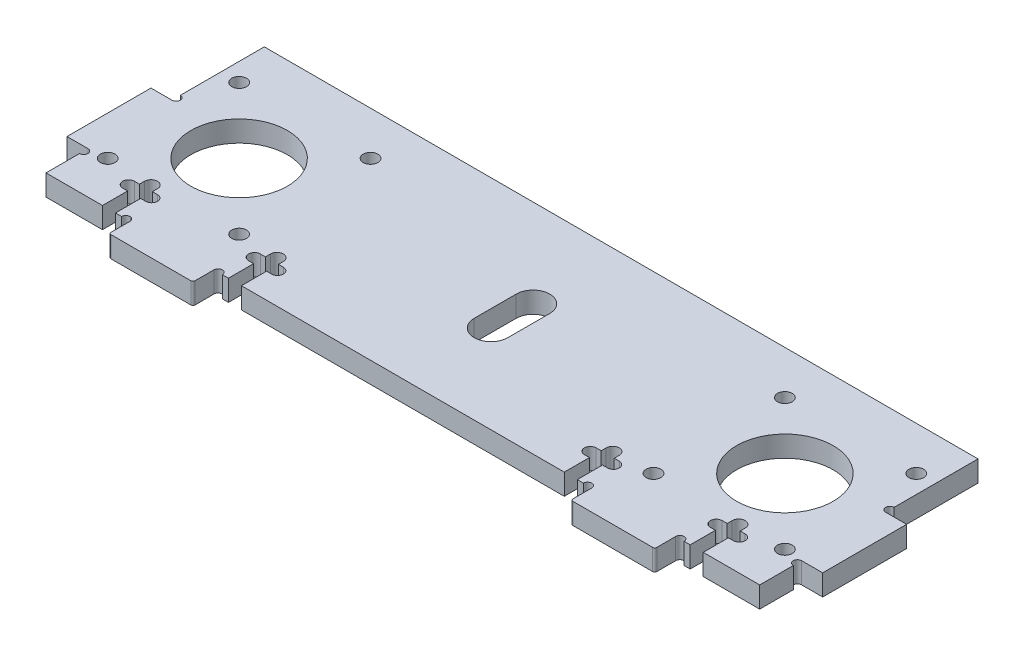
from build123d import *

# Parameters (mm, degrees)
SKETCH_1_W          = 170
SKETCH_1_H          = 52
EXTRUDE_1_DEPTH     = 5
SKETCH_2_R          = 11.5
SKETCH_2_R_2        = 1.75
CUT_EXTRUDE_1_DEPTH = 5
SKETCH_3_W          = 20
SKETCH_3_H          = 5
EXTRUDE_2_DEPTH     = 5
SKETCH_4_R          = 1
CUT_EXTRUDE_2_DEPTH = 5
CUT_EXTRUDE_3_DEPTH = 10
FILLET_1_R          = 0.5
CUT_EXTRUDE_4_DEPTH = 10
SKETCH_7_W          = 5
SKETCH_7_H          = 20
EXTRUDE_3_DEPTH     = 5
SKETCH_8_R          = 1
CUT_EXTRUDE_5_DEPTH = 5


with BuildPart() as part:
    # 스케치1 → 보스-돌출1 (new body)
    with BuildSketch(Plane(origin=(0, 0, 0), x_dir=(1, 0, 0), z_dir=(0, 1, 0))):
        with Locations((85, 26)):
            Rectangle(SKETCH_1_W, SKETCH_1_H)
    extrude(amount=EXTRUDE_1_DEPTH)

    # 스케치2 → 컷-돌출1 (cut)
    with BuildSketch(Plane(origin=(0, 5, 0), x_dir=(1, 0, 0), z_dir=(0, 1, 0))):
        with Locations((150, 26)):
            Circle(SKETCH_2_R)
        with Locations((165.65, 41.65)):
            Circle(SKETCH_2_R_2)
        with Locations((134.35, 41.65)):
            Circle(SKETCH_2_R_2)
        with Locations((165.65, 10.35)):
            Circle(SKETCH_2_R_2)
        with Locations((134.35, 10.35)):
            Circle(SKETCH_2_R_2)
        with Locations((35.65, 10.35)):
            Circle(SKETCH_2_R_2)
        with Locations((4.35, 10.35)):
            Circle(SKETCH_2_R_2)
        with Locations((35.65, 41.65)):
            Circle(SKETCH_2_R_2)
        with Locations((4.35, 41.65)):
            Circle(SKETCH_2_R_2)
        with Locations((20, 26)):
            Circle(SKETCH_2_R)
    extrude(amount=-CUT_EXTRUDE_1_DEPTH, mode=Mode.SUBTRACT)

    # 스케치3 → 보스-돌출2 (add)
    with BuildSketch(Plane(origin=(0, 5, 0), x_dir=(1, 0, 0), z_dir=(0, 1, 0))):
        with Locations((140, -2.5)):
            Rectangle(SKETCH_3_W, SKETCH_3_H)
        with Locations((30, -2.5)):
            Rectangle(SKETCH_3_W, SKETCH_3_H)
    extrude(amount=-EXTRUDE_2_DEPTH)

    # 스케치4 → 컷-돌출2 (cut)
    with BuildSketch(Plane(origin=(0, 5, 0), x_dir=(1, 0, 0), z_dir=(0, 1, 0))):
        with Locations((129, 0)):
            Circle(SKETCH_4_R)
        with Locations((151, 0)):
            Circle(SKETCH_4_R)
        with Locations((19, 0)):
            Circle(SKETCH_4_R)
        with Locations((41, 0)):
            Circle(SKETCH_4_R)
    extrude(amount=-CUT_EXTRUDE_2_DEPTH, mode=Mode.SUBTRACT)

    # 스케치5 → 컷-돌출3 (cut)
    with BuildSketch(Plane(origin=(0, 5, 0), x_dir=(1, 0, 0), z_dir=(0, 1, 0))):
        with BuildLine():
            Line((156.55, 0), (156.55, 6))
            Line((156.55, 6), (157.75, 6))
            ThreePointArc((157.75, 6), (159.15, 7.4), (157.75, 8.8))
            Line((157.75, 8.8), (156.55, 8.8))
            Line((156.55, 8.8), (156.55, 10))
            ThreePointArc((156.55, 10), (155, 11.55), (153.45, 10))
            Line((153.45, 10), (153.45, 8.8))
            Line((153.45, 8.8), (152.25, 8.8))
            ThreePointArc((152.25, 8.8), (150.85, 7.4), (152.25, 6))
            Line((152.25, 6), (153.45, 6))
            Line((153.45, 6), (153.45, 0))
            Line((153.45, 0), (156.55, 0))
        make_face()
        with BuildLine():
            Line((126.55, 0), (126.55, 6))
            Line((126.55, 6), (127.75, 6))
            ThreePointArc((127.75, 6), (129.15, 7.4), (127.75, 8.8))
            Line((127.75, 8.8), (126.55, 8.8))
            Line((126.55, 8.8), (126.55, 10))
            ThreePointArc((126.55, 10), (125, 11.55), (123.45, 10))
            Line((123.45, 10), (123.45, 8.8))
            Line((123.45, 8.8), (122.25, 8.8))
            ThreePointArc((122.25, 8.8), (120.85, 7.4), (122.25, 6))
            Line((122.25, 6), (123.45, 6))
            Line((123.45, 6), (123.45, 0))
            Line((123.45, 0), (126.55, 0))
        make_face()
        with BuildLine():
            Line((42.25, 6), (43.45, 6))
            Line((43.45, 6), (43.45, 0))
            Line((43.45, 0), (46.55, 0))
            Line((46.55, 0), (46.55, 6))
            Line((46.55, 6), (47.75, 6))
            ThreePointArc((47.75, 6), (49.15, 7.4), (47.75, 8.8))
            Line((47.75, 8.8), (46.55, 8.8))
            Line((46.55, 8.8), (46.55, 10))
            ThreePointArc((46.55, 10), (45, 11.55), (43.45, 10))
            Line((43.45, 10), (43.45, 8.8))
            Line((43.45, 8.8), (42.25, 8.8))
            ThreePointArc((42.25, 8.8), (40.85, 7.4), (42.25, 6))
        make_face()
        with BuildLine():
            Line((12.25, 6), (13.45, 6))
            Line((13.45, 6), (13.45, 0))
            Line((13.45, 0), (16.55, 0))
            Line((16.55, 0), (16.55, 6))
            Line((16.55, 6), (17.75, 6))
            ThreePointArc((17.75, 6), (19.15, 7.4), (17.75, 8.8))
            Line((17.75, 8.8), (16.55, 8.8))
            Line((16.55, 8.8), (16.55, 10))
            ThreePointArc((16.55, 10), (15, 11.55), (13.45, 10))
            Line((13.45, 10), (13.45, 8.8))
            Line((13.45, 8.8), (12.25, 8.8))
            ThreePointArc((12.25, 8.8), (10.85, 7.4), (12.25, 6))
        make_face()
    extrude(amount=-CUT_EXTRUDE_3_DEPTH, mode=Mode.SUBTRACT)

    # 필렛1
    fillet_1_edges = [part.edges().sort_by_distance(p)[0] for p in [
        (20, 2.5, 5),
        (130, 2.5, 5),
        (150, 2.5, 5),
        (40, 2.5, 5),
    ]]
    fillet(fillet_1_edges, radius=FILLET_1_R)

    # 스케치6 → 컷-돌출4 (cut)
    with BuildSketch(Plane(origin=(0, 5, 0), x_dir=(1, 0, 0), z_dir=(0, 1, 0))):
        with BuildLine():
            Line((81, 21), (81, 31))
            ThreePointArc((81, 31), (85, 35), (89, 31))
            Line((89, 31), (89, 21))
            ThreePointArc((89, 21), (85, 17), (81, 21))
        make_face()
    extrude(amount=-CUT_EXTRUDE_4_DEPTH, mode=Mode.SUBTRACT)

    # 스케치7 → 보스-돌출3 (add)
    with BuildSketch(Plane(origin=(0, 5, 0), x_dir=(1, 0, 0), z_dir=(0, 1, 0))):
        with Locations((172.5, 20)):
            Rectangle(SKETCH_7_W, SKETCH_7_H)
        with Locations((-2.5, 20)):
            Rectangle(SKETCH_7_W, SKETCH_7_H)
    extrude(amount=-EXTRUDE_3_DEPTH)

    # 스케치8 → 컷-돌출5 (cut)
    with BuildSketch(Plane(origin=(0, 5, 0), x_dir=(1, 0, 0), z_dir=(0, 1, 0))):
        with Locations((170, 9)):
            Circle(SKETCH_8_R)
        with Locations((170, 31)):
            Circle(SKETCH_8_R)
        with Locations((0, 9)):
            Circle(SKETCH_8_R)
        with Locations((0, 31)):
            Circle(SKETCH_8_R)
    extrude(amount=-CUT_EXTRUDE_5_DEPTH, mode=Mode.SUBTRACT)


solid = part.part
